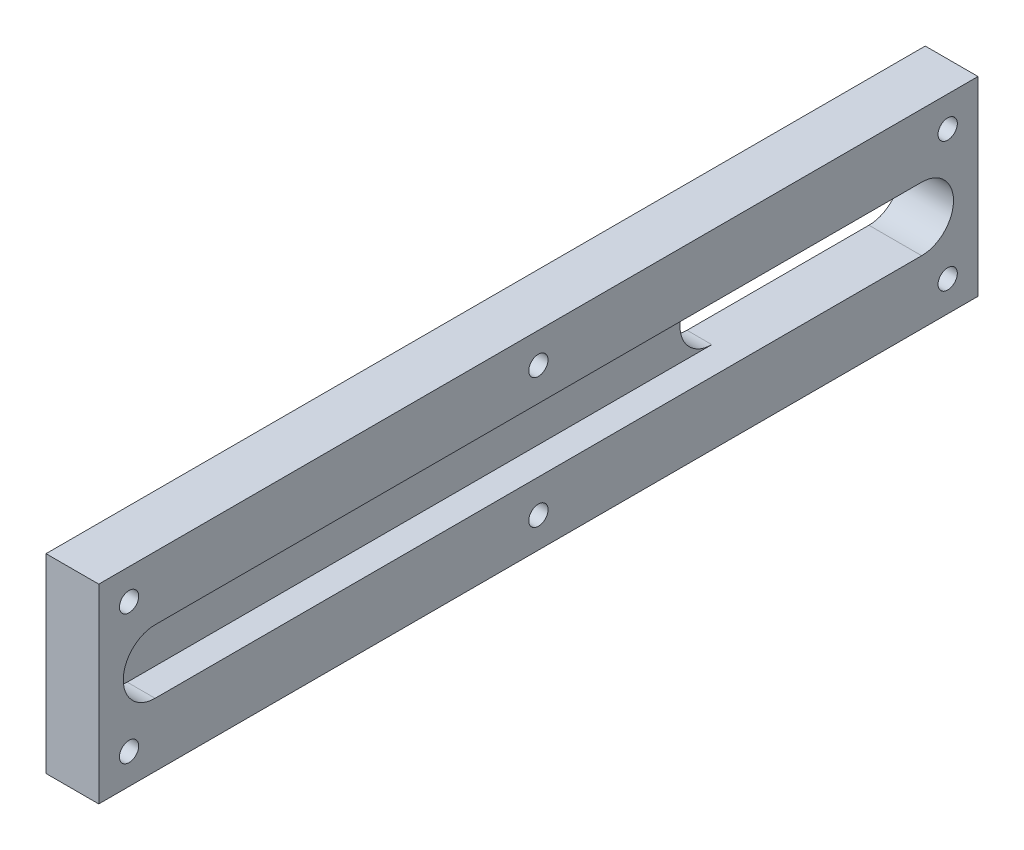
from build123d import *

# Parameters (mm, degrees)
SKETCH1_W              = 184.15
SKETCH1_H              = 39.878
BOSS_EXTRUDE1_DEPTH    = 11.049
F_10_32_TAPPED_HOLE1_D = 4.0386
BOSS_EXTRUDE2_DEPTH    = 5.207


with BuildPart() as part:
    # Sketch1 → Boss-Extrude1 (new body)
    with BuildSketch(Plane(origin=(0, 0, 0), x_dir=(0, 0, -1), z_dir=(1, 0, 0))):
        Rectangle(SKETCH1_W, SKETCH1_H)
        with BuildLine():
            Line((-80.27524839, 6.6675), (80.27524839, 6.6675))
            ThreePointArc((80.27524839, 6.6675), (86.94274839, 0), (80.27524839, -6.6675))
            Line((80.27524839, -6.6675), (-80.27524839, -6.6675))
            ThreePointArc((-80.27524839, -6.6675), (-86.94274839, 0), (-80.27524839, 6.6675))
        make_face(mode=Mode.SUBTRACT)
    extrude(amount=BOSS_EXTRUDE1_DEPTH)

    # #10-32 Tapped Hole1 (through all)
    with Locations(Plane(origin=(11.049, 0, 0), x_dir=(0, 0, -1), z_dir=(1, 0, 0))):
        with Locations((-85.725, 13.589), (-85.725, -13.589), (0, -13.589), (85.725, -13.589), (85.725, 13.589), (0, 13.589)):
            Hole(F_10_32_TAPPED_HOLE1_D / 2)

    # Sketch5 → Boss-Extrude2 (add)
    with BuildSketch(Plane.ZY):
        with BuildLine():
            Line((-42.17524839, -6.6675), (80.27524839, -6.6675))
            ThreePointArc((80.27524839, -6.6675), (86.94274839, 0), (80.27524839, 6.6675))
            Line((80.27524839, 6.6675), (-42.17524839, 6.6675))
            ThreePointArc((-42.17524839, 6.6675), (-35.50774839, 0), (-42.17524839, -6.6675))
        make_face()
    extrude(amount=-BOSS_EXTRUDE2_DEPTH)


solid = part.part
